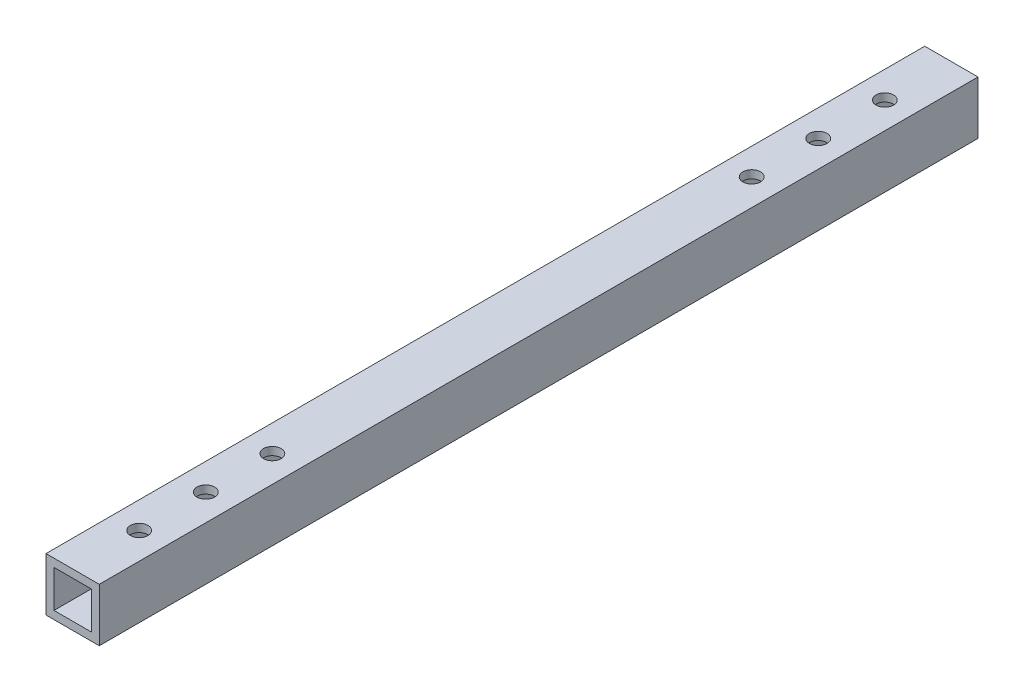
from build123d import *

# Parameters (mm, degrees)
SKETCH_1_W          = 10
SKETCH_1_H          = 10
SKETCH_1_W_2        = 7
SKETCH_1_H_2        = 7
EXTRUDE_1_DEPTH     = 165
SKETCH_2_R          = 1.65
CUT_EXTRUDE_1_DEPTH = 166.378354085


with BuildPart() as part:
    # 草图1 → 凸台-拉伸1 (new body)
    with BuildSketch(Plane.XY):
        Rectangle(SKETCH_1_W, SKETCH_1_H)
        Rectangle(SKETCH_1_W_2, SKETCH_1_H_2, mode=Mode.SUBTRACT)
    extrude(amount=EXTRUDE_1_DEPTH)

    # 草图2 → 切除-拉伸1 (cut, through all)
    with BuildSketch(Plane(origin=(0, 5, 0), x_dir=(1, 0, 0), z_dir=(0, 1, 0))):
        with Locations((0, -12.5)):
            Circle(SKETCH_2_R)
        with Locations((0, -25)):
            Circle(SKETCH_2_R)
        with Locations((0, -37.5)):
            Circle(SKETCH_2_R)
        with Locations((0, -127.5)):
            Circle(SKETCH_2_R)
        with Locations((0, -140)):
            Circle(SKETCH_2_R)
        with Locations((0, -152.5)):
            Circle(SKETCH_2_R)
    extrude(amount=-CUT_EXTRUDE_1_DEPTH, mode=Mode.SUBTRACT)


solid = part.part
